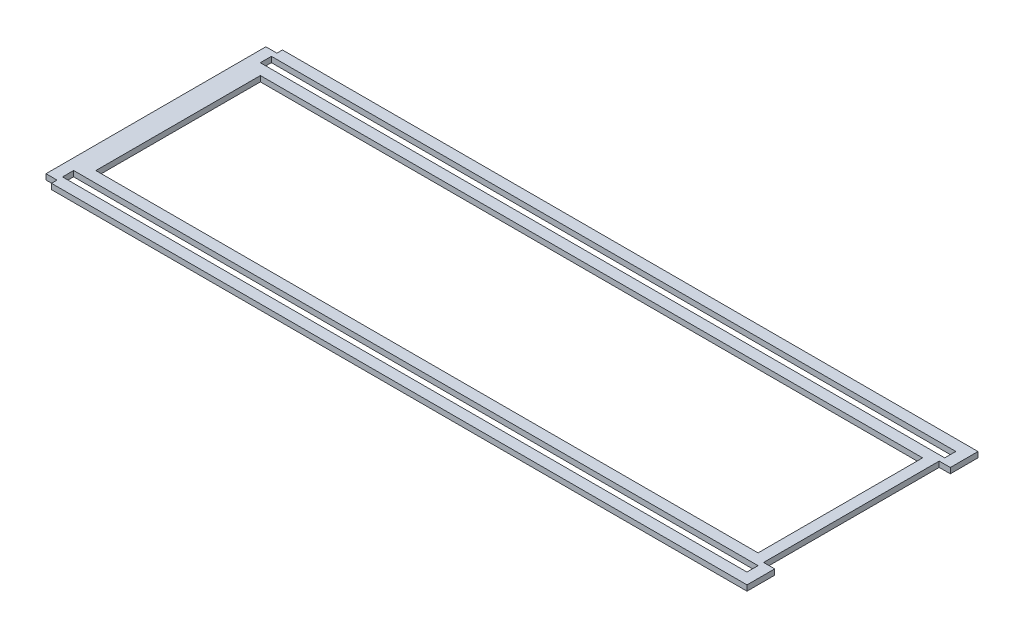
from build123d import *

# Parameters (mm, degrees)
SKETCH1_W           = 393.6492
SKETCH1_H           = 6.4008
SKETCH1_W_2         = 380.8984
SKETCH1_H_2         = 94.6531
BOSS_EXTRUDE1_DEPTH = 3.175


with BuildPart() as part:
    # Sketch1 → Boss-Extrude1 (new body)
    with BuildSketch(Plane(origin=(0, 0, 0), x_dir=(1, 0, 0), z_dir=(0, 1, 0))):
        Polygon((-203.2, 63.22695), (-203.2, -58.245375), (-203.2, -63.22695), (-196.85, -63.22695), (-196.85, -66.42735), (203.2, -66.42735), (203.2, -50.50155), (196.7992, -50.50155), (196.7992, 50.50155), (203.2, 50.50155), (203.2, 66.42735), (-196.85, 66.42735), (-196.85, 63.22695), align=None)
        with Locations((-0.0254, 56.87695)):
            Rectangle(SKETCH1_W, SKETCH1_H, mode=Mode.SUBTRACT)
        with Locations((-0.0254, -56.87695)):
            Rectangle(SKETCH1_W, SKETCH1_H, mode=Mode.SUBTRACT)
        Rectangle(SKETCH1_W_2, SKETCH1_H_2, mode=Mode.SUBTRACT)
    extrude(amount=BOSS_EXTRUDE1_DEPTH)


solid = part.part
